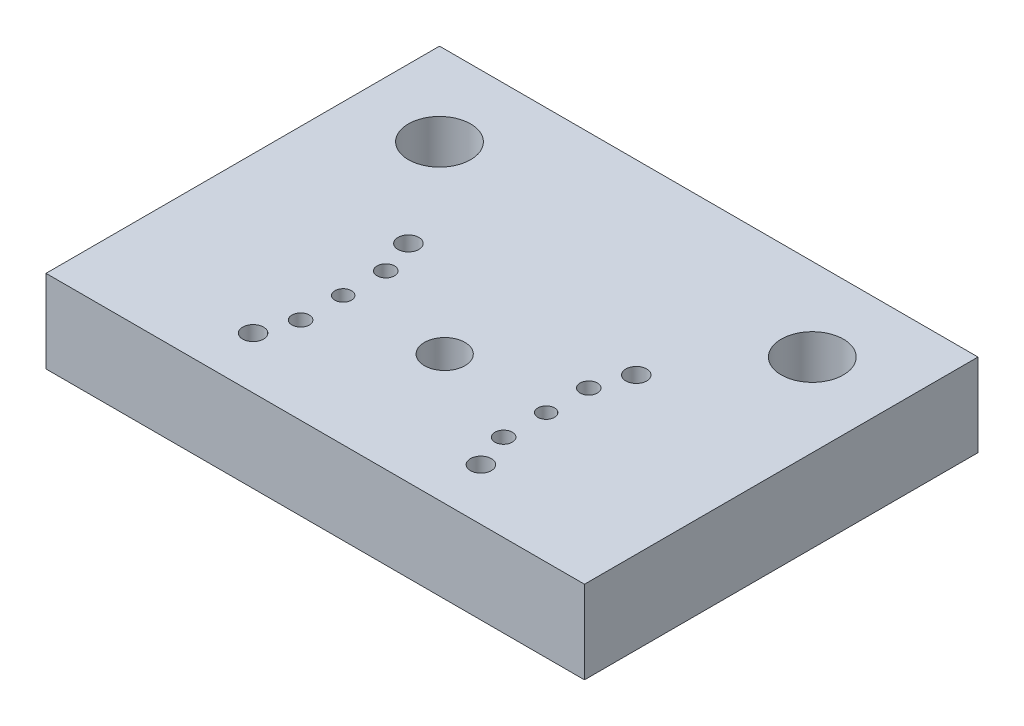
from build123d import *

# Parameters (mm, degrees)
SKETCH1_W                                           = 260
SKETCH1_H                                           = 190
BOSS_EXTRUDE1_DEPTH                                 = 40
SKETCH2_R                                           = 15
CUT_EXTRUDE1_DEPTH                                  = 166.90660023
SKETCH3_R                                           = 5.05
CUT_EXTRUDE2_DEPTH                                  = 166.90660023
SKETCH4_R                                           = 9.770548986
CUT_EXTRUDE3_DEPTH                                  = 166.90660023
CBORE_FOR_M8_HEX_SOCKET_HEAD_CAP_SCREW1_D           = 8.4
CBORE_FOR_M8_HEX_SOCKET_HEAD_CAP_SCREW1_CBORE_D     = 15
CBORE_FOR_M8_HEX_SOCKET_HEAD_CAP_SCREW1_CBORE_DEPTH = 8.6
F_8_0MM_DOWEL_HOLE1_D                               = 8


with BuildPart() as part:
    # Sketch1 → Boss-Extrude1 (new body)
    with BuildSketch(Plane(origin=(0, 0, 0), x_dir=(1, 0, 0), z_dir=(0, 1, 0))):
        Rectangle(SKETCH1_W, SKETCH1_H)
    extrude(amount=-BOSS_EXTRUDE1_DEPTH)

    # Sketch2 → Cut-Extrude1 (cut, through all)
    with BuildSketch(Plane(origin=(0, 0, 0), x_dir=(1, 0, 0), z_dir=(0, 1, 0))):
        with Locations((-90, 55)):
            Circle(SKETCH2_R)
        with Locations((90, 55)):
            Circle(SKETCH2_R)
    extrude(amount=-CUT_EXTRUDE1_DEPTH, mode=Mode.SUBTRACT)

    # Sketch3 → Cut-Extrude2 (cut, through all)
    with BuildSketch(Plane.XZ.offset(40)):
        with Locations((-55, 70)):
            Circle(SKETCH3_R)
        with Locations((55, 70)):
            Circle(SKETCH3_R)
        with Locations((55, -5)):
            Circle(SKETCH3_R)
        with Locations((-55, -5)):
            Circle(SKETCH3_R)
    extrude(amount=-CUT_EXTRUDE2_DEPTH, mode=Mode.SUBTRACT)

    # Sketch4 → Cut-Extrude3 (cut, through all)
    with BuildSketch(Plane.XZ.offset(40)):
        with Locations((0, 32.5)):
            Circle(SKETCH4_R)
    extrude(amount=-CUT_EXTRUDE3_DEPTH, mode=Mode.SUBTRACT)

    # CBORE for M8 Hex Socket Head Cap Screw1 (through all)
    with Locations(Plane(origin=(0, -40, 0), x_dir=(-1, 0, 0), z_dir=(0, -1, 0))):
        with Locations((-49, -11.95), (-49, -53.05), (49, -53.05), (49, -11.95)):
            CounterBoreHole(CBORE_FOR_M8_HEX_SOCKET_HEAD_CAP_SCREW1_D / 2, CBORE_FOR_M8_HEX_SOCKET_HEAD_CAP_SCREW1_CBORE_D / 2, CBORE_FOR_M8_HEX_SOCKET_HEAD_CAP_SCREW1_CBORE_DEPTH)

    # Ø8.0mm Dowel Hole1 (through all)
    with Locations(Plane(origin=(0, -40, 0), x_dir=(-1, 0, 0), z_dir=(0, -1, 0))):
        with Locations((-49, -32.5), (49, -32.5)):
            Hole(F_8_0MM_DOWEL_HOLE1_D / 2)


solid = part.part
